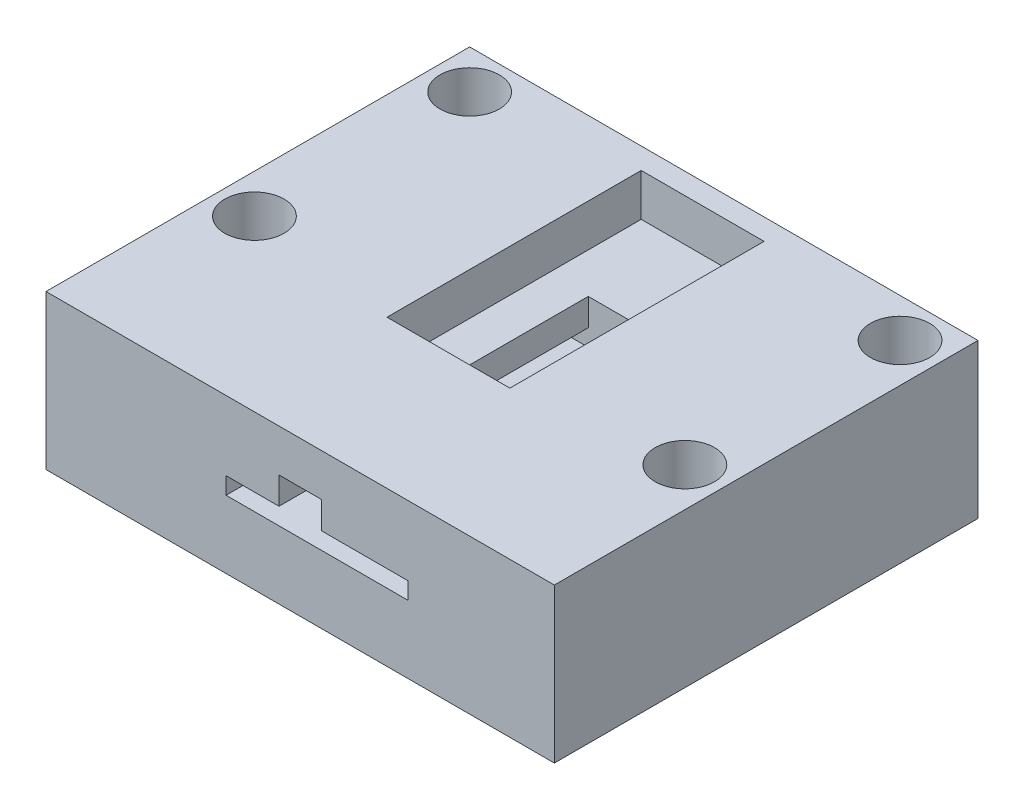
from build123d import *

# Parameters (mm, degrees)
SKETCH2_W               = 60
SKETCH2_H               = 50
BOSS_EXTRUDE1_DEPTH     = 10
SKETCH3_W               = 21.5
SKETCH3_H               = 36.5
CUT_EXTRUDE2_DEPTH      = 2
BOSS_EXTRUDE2_DEPTH     = 3.2
SKETCH5_W               = 60
SKETCH5_H               = 50
SKETCH5_W_2             = 14.5
SKETCH5_H_2             = 30
BOSS_EXTRUDE3_DEPTH     = 5
CUT_EXTRUDE1_DEPTH      = 80.210100366
CUT_EXTRUDE1_DEPTH_BACK = 80.210100366
SKETCH1_R               = 3.5


with BuildPart() as part:
    # Sketch2 → Boss-Extrude1 (new body)
    with BuildSketch(Plane(origin=(0, 0, 0), x_dir=(1, 0, 0), z_dir=(0, 1, 0))):
        with Locations((30, 25)):
            Rectangle(SKETCH2_W, SKETCH2_H)
    extrude(amount=BOSS_EXTRUDE1_DEPTH)

    # Sketch3 → Cut-Extrude2 (cut)
    with BuildSketch(Plane(origin=(0, 10, 0), x_dir=(1, 0, 0), z_dir=(0, 1, 0))):
        with Locations((32, 18.25)):
            Rectangle(SKETCH3_W, SKETCH3_H)
    extrude(amount=-CUT_EXTRUDE2_DEPTH, mode=Mode.SUBTRACT)

    # Sketch4 → Boss-Extrude2 (add)
    with BuildSketch(Plane(origin=(0, 10, 0), x_dir=(1, 0, 0), z_dir=(0, 1, 0))):
        Polygon((27.5, 0), (27.5, 36.5), (32.5, 36.5), (32.5, 0), (60, 0), (60, 50), (0, 50), (0, 0), align=None)
    extrude(amount=BOSS_EXTRUDE2_DEPTH)

    # Sketch5 → Boss-Extrude3 (add)
    with BuildSketch(Plane(origin=(0, 13.2, 0), x_dir=(1, 0, 0), z_dir=(0, 1, 0))):
        with Locations((30, 25)):
            Rectangle(SKETCH5_W, SKETCH5_H)
        with Locations((30, 32.5)):
            Rectangle(SKETCH5_W_2, SKETCH5_H_2, mode=Mode.SUBTRACT)
    extrude(amount=BOSS_EXTRUDE3_DEPTH)

    # Sketch1 → Cut-Extrude1 (cut, two sides: drawn at the far end of the back side and taken through both)
    with BuildSketch(Plane(origin=(0, 13.2, 0), x_dir=(1, 0, 0), z_dir=(0, 1, 0)).offset(-CUT_EXTRUDE1_DEPTH_BACK)):
        with Locations((4.6, 45.4)):
            Circle(SKETCH1_R)
        with Locations((4.6, 20)):
            Circle(SKETCH1_R)
        with Locations((55.4, 45.4)):
            Circle(SKETCH1_R)
        with Locations((55.4, 20)):
            Circle(SKETCH1_R)
    extrude(amount=CUT_EXTRUDE1_DEPTH + CUT_EXTRUDE1_DEPTH_BACK, mode=Mode.SUBTRACT)


solid = part.part
